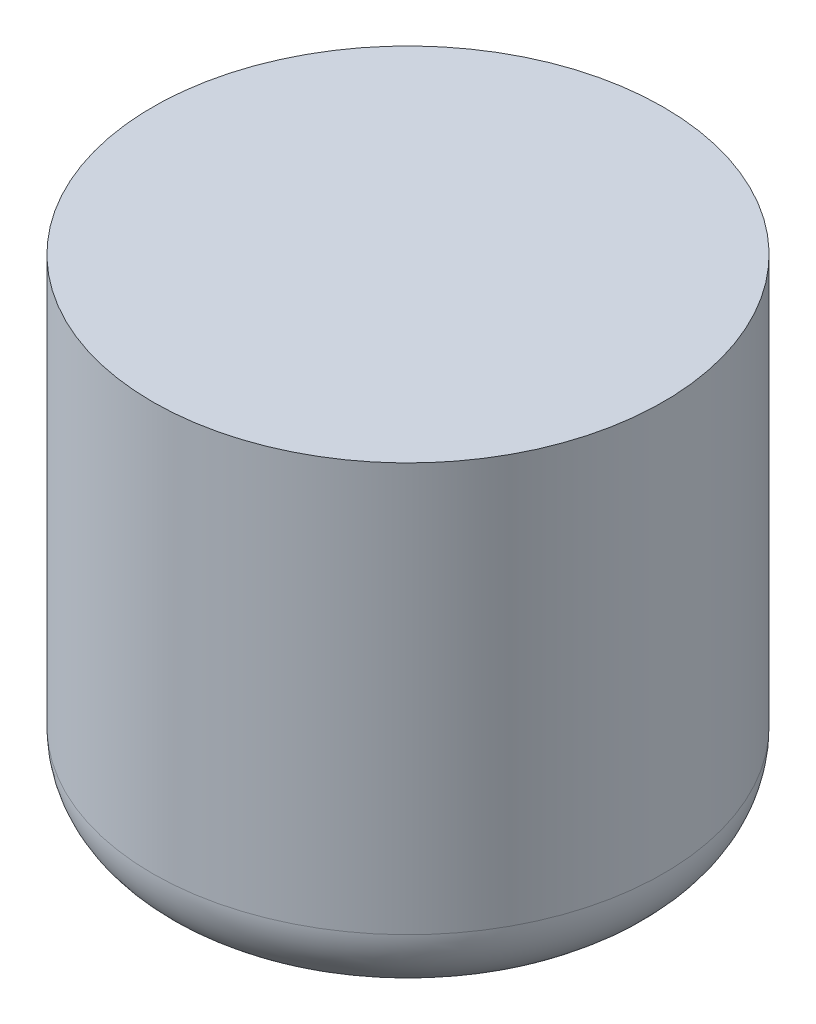
from build123d import *


with BuildPart() as part:
    # Sketch1 → Revolve1 (revolve)
    with BuildSketch(Plane.XY):
        with BuildLine():
            Line((0, 170), (0, 770))
            Line((0, 770), (375, 770))
            Line((375, 770), (375, 170))
            ThreePointArc((375, 170), (355.761111541, 108.967221921), (305, 70))
            ThreePointArc((305, 70), (155.956040974, 19.941535756), (0, 0))
            Line((0, 0), (0, 170))
        make_face()
    revolve(axis=Axis((0, 170, 0), (0, 1, 0)))


solid = part.part
